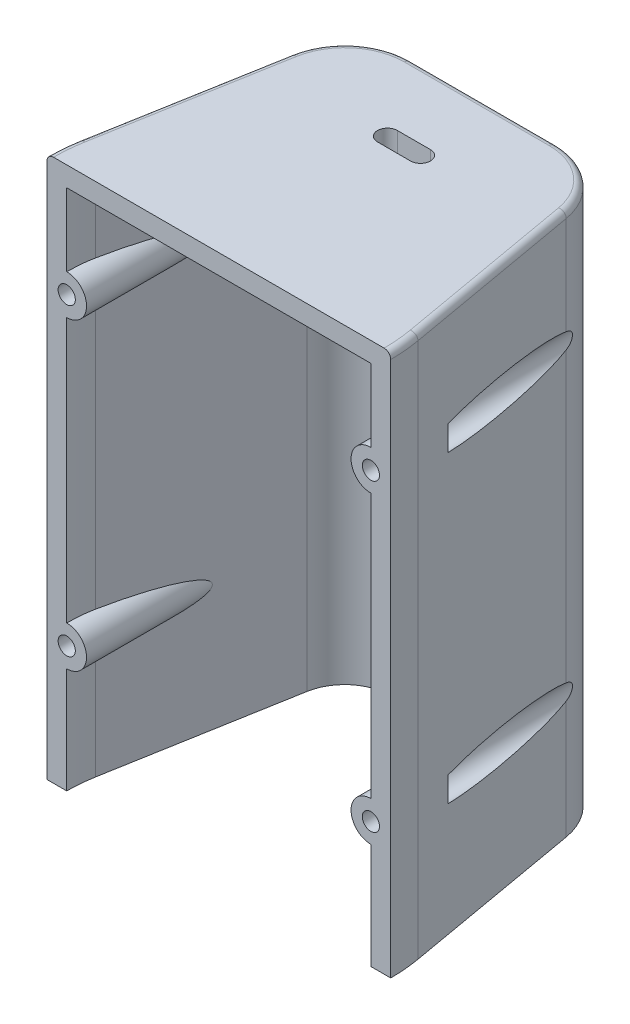
from build123d import *

# Parameters (mm, degrees)
EXTRUDE_1_DEPTH     = 82
EXTRUDE_START       = -3
EXTRUDE_2_DEPTH     = 3
EXTRUDE_4_REACH     = 96.868
SKETCH_24_R         = 3
EXTRUDE_5_REACH     = 96.868
SKETCH_24_4_R       = 3
FILLET_1_R          = 1
SKETCH_27_R         = 1.3
CUT_EXTRUDE_3_DEPTH = 95.868329919
CUT_EXTRUDE_START   = -10
SKETCH_28_R         = 2.5
CUT_EXTRUDE_4_DEPTH = 85.868329919
CUT_EXTRUDE_5_REACH = 96.868


with BuildPart() as part:
    # Эскиз22 → Бобышка-Вытянуть1 (new body)
    with BuildSketch(Plane(origin=(0, 0, 0), x_dir=(1, 0, 0), z_dir=(0, 1, 0))):
        with BuildLine():
            Line((-25.605001578, 4.514852619), (-20.805093899, 31.736481777))
            ThreePointArc((-20.805093899, 31.736481777), (-17.384892466, 37.660444431), (-10.957016369, 40))
            Line((-10.957016369, 40), (0, 40))
            Line((0, 40), (10.957016369, 40))
            ThreePointArc((10.957016369, 40), (17.384892466, 37.660444431), (20.805093899, 31.736481777))
            Line((20.805093899, 31.736481777), (25.605001578, 4.514852619))
            ThreePointArc((25.605001578, 4.514852619), (25.90106215, 2.266049311), (26, 0))
            Line((26, 0), (23, 0))
            ThreePointArc((23, 0), (22.912478056, 2.004582083), (22.650578319, 3.993908086))
            Line((22.650578319, 3.993908086), (17.85067064, 31.215537244))
            ThreePointArc((17.85067064, 31.215537244), (15.456529637, 35.362311102), (10.957016369, 37))
            Line((10.957016369, 37), (0, 37))
            Line((0, 37), (-10.957016369, 37))
            ThreePointArc((-10.957016369, 37), (-15.456529637, 35.362311102), (-17.85067064, 31.215537244))
            Line((-17.85067064, 31.215537244), (-22.650578319, 3.993908086))
            ThreePointArc((-22.650578319, 3.993908086), (-22.912478056, 2.004582083), (-23, 0))
            Line((-23, 0), (-26, 0))
            ThreePointArc((-26, 0), (-25.90106215, 2.266049311), (-25.605001578, 4.514852619))
        make_face()
    extrude(amount=EXTRUDE_1_DEPTH)

    # Эскиз23 → Бобышка-Вытянуть2 (add)
    with BuildSketch(Plane(origin=(0, 82, 0), x_dir=(1, 0, 0), z_dir=(0, 1, 0)).offset(EXTRUDE_START)):
        with BuildLine():
            Line((-25.605001578, 4.514852619), (-20.805093899, 31.736481777))
            ThreePointArc((-20.805093899, 31.736481777), (-17.384892466, 37.660444431), (-10.957016369, 40))
            Line((-10.957016369, 40), (10.957016369, 40))
            ThreePointArc((10.957016369, 40), (17.384892466, 37.660444431), (20.805093899, 31.736481777))
            Line((20.805093899, 31.736481777), (25.605001578, 4.514852619))
            ThreePointArc((25.605001578, 4.514852619), (25.90106215, 2.266049311), (26, 0))
            Line((26, 0), (-26, 0))
            ThreePointArc((-26, 0), (-25.90106215, 2.266049311), (-25.605001578, 4.514852619))
        make_face()
    extrude(amount=EXTRUDE_2_DEPTH)

    # Бобышка-Вытянуть4: up to this face of the body (flat: up to its plane)
    extrude_4_end = Plane(part.part.faces().sort_by_distance((20.25062448, 39.5, -17.604722665))[0])
    # Эскиз24 → Бобышка-Вытянуть4 (add, up to the picked face)
    with BuildSketch(Plane.XY, mode=Mode.PRIVATE) as extrude_4_sk1:
        with Locations((23, 65)):
            Circle(SKETCH_24_R)
    extrude_4_tool1 = split(extrude(extrude_4_sk1.sketch, amount=-EXTRUDE_4_REACH, mode=Mode.PRIVATE), bisect_by=extrude_4_end, keep=Keep.BOTH, mode=Mode.PRIVATE)
    # Эскиз24 → Бобышка-Вытянуть4 (add, up to the picked face)
    with BuildSketch(Plane.XY, mode=Mode.PRIVATE) as extrude_4_sk2:
        with Locations((23, 19)):
            Circle(SKETCH_24_R)
    extrude_4_tool2 = split(extrude(extrude_4_sk2.sketch, amount=-EXTRUDE_4_REACH, mode=Mode.PRIVATE), bisect_by=extrude_4_end, keep=Keep.BOTH, mode=Mode.PRIVATE)
    add(extrude_4_tool1.solids().sort_by(Axis((23, 65, 0), (0, 0, -1)))[0])
    add(extrude_4_tool2.solids().sort_by(Axis((23, 19, 0), (0, 0, -1)))[0])

    # Бобышка-Вытянуть5: up to this face of the body (flat: up to its plane)
    extrude_5_end = Plane(part.part.faces().sort_by_distance((-20.25062448, 39.5, -17.604722665))[0])
    # Эскиз24<4> → Бобышка-Вытянуть5 (add, up to the picked face)
    with BuildSketch(Plane.XY, mode=Mode.PRIVATE) as extrude_5_sk1:
        with Locations((-23, 65)):
            Circle(SKETCH_24_4_R)
    extrude_5_tool1 = split(extrude(extrude_5_sk1.sketch, amount=-EXTRUDE_5_REACH, mode=Mode.PRIVATE), bisect_by=extrude_5_end, keep=Keep.BOTH, mode=Mode.PRIVATE)
    # Эскиз24<4> → Бобышка-Вытянуть5 (add, up to the picked face)
    with BuildSketch(Plane.XY, mode=Mode.PRIVATE) as extrude_5_sk2:
        with Locations((-23, 19)):
            Circle(SKETCH_24_4_R)
    extrude_5_tool2 = split(extrude(extrude_5_sk2.sketch, amount=-EXTRUDE_5_REACH, mode=Mode.PRIVATE), bisect_by=extrude_5_end, keep=Keep.BOTH, mode=Mode.PRIVATE)
    add(extrude_5_tool1.solids().sort_by(Axis((-23, 65, 0), (0, 0, -1)))[0])
    add(extrude_5_tool2.solids().sort_by(Axis((-23, 19, 0), (0, 0, -1)))[0])

    # Скругление1
    fillet_1_edges = [part.edges().sort_by_distance(p)[0] for p in [
        (25.90106215, 82, -2.266049311),
        (23.205047739, 82, -18.125667198),
        (17.384892466, 82, -37.660444431),
        (0, 82, -40),
        (-17.384892466, 82, -37.660444431),
        (-23.205047739, 82, -18.125667198),
        (-25.90106215, 82, -2.266049311),
    ]]
    fillet(fillet_1_edges, radius=FILLET_1_R)

    # Эскиз27 → Вырез-Вытянуть3 (cut, through all)
    with BuildSketch(Plane.XY):
        with Locations((-23, 65)):
            Circle(SKETCH_27_R)
        with Locations((23, 65)):
            Circle(SKETCH_27_R)
        with Locations((23, 19)):
            Circle(SKETCH_27_R)
        with Locations((-23, 19)):
            Circle(SKETCH_27_R)
    extrude(amount=-CUT_EXTRUDE_3_DEPTH, mode=Mode.SUBTRACT)

    # Эскиз28 → Вырез-Вытянуть4 (cut, through all)
    with BuildSketch(Plane.XY.offset(CUT_EXTRUDE_START)):
        with Locations((-23, 65)):
            Circle(SKETCH_28_R)
        with Locations((23, 65)):
            Circle(SKETCH_28_R)
        with Locations((23, 19)):
            Circle(SKETCH_28_R)
        with Locations((-23, 19)):
            Circle(SKETCH_28_R)
    extrude(amount=-CUT_EXTRUDE_4_DEPTH, mode=Mode.SUBTRACT)

    # Эскиз29 → Вырез-Вытянуть5 (cut, up to next)
    with BuildSketch(Plane(origin=(0, 82, 0), x_dir=(1, 0, 0), z_dir=(0, 1, 0)), mode=Mode.PRIVATE) as cut_extrude_5_sk1:
        with BuildLine():
            Line((-2.5, 29.5), (2.5, 29.5))
            ThreePointArc((2.5, 29.5), (4, 28), (2.5, 26.5))
            Line((2.5, 26.5), (-2.5, 26.5))
            ThreePointArc((-2.5, 26.5), (-4, 28), (-2.5, 29.5))
        make_face()
    cut_extrude_5_tool1 = extrude(cut_extrude_5_sk1.sketch, amount=-CUT_EXTRUDE_5_REACH, mode=Mode.PRIVATE) & part.part
    add(cut_extrude_5_tool1.solids().sort_by_distance((0, 82, -28))[0], mode=Mode.SUBTRACT)


solid = part.part
